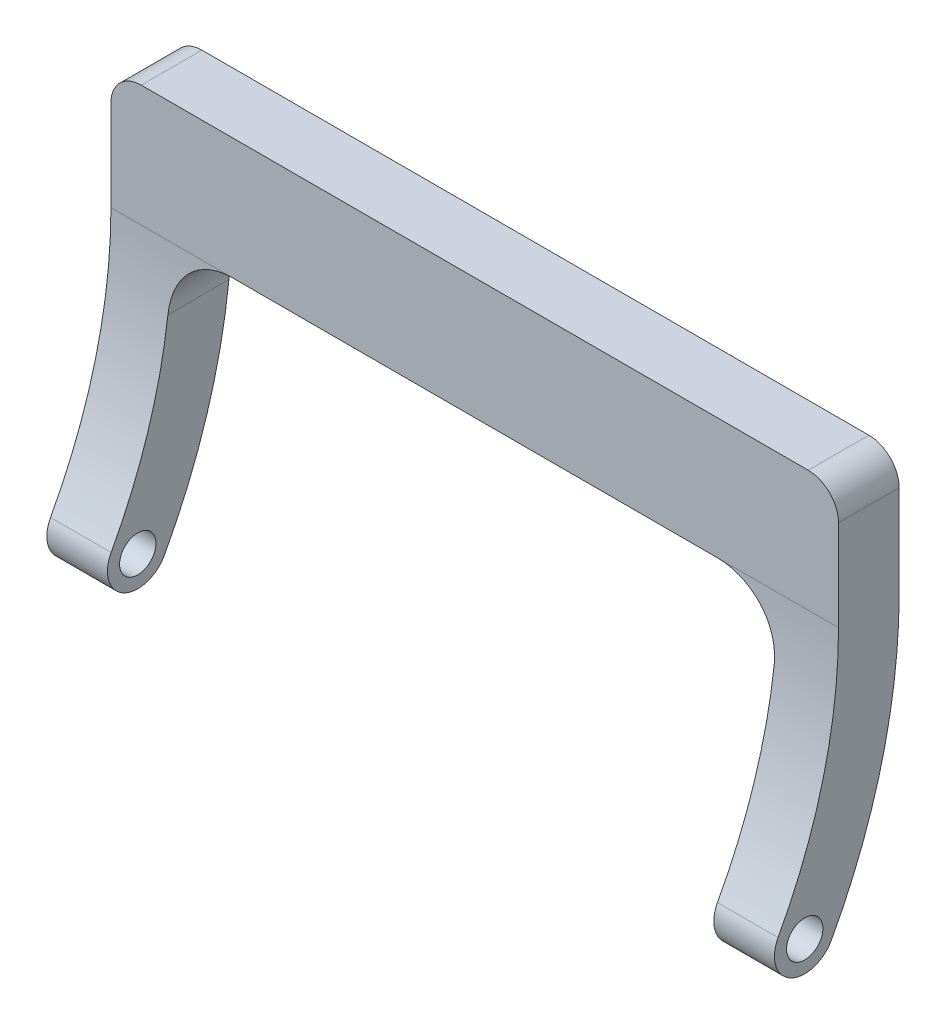
from build123d import *

# Parameters (mm, degrees)
BOSS_EXTRU_1_DEPTH      = 5
ESQUISSE3_R             = 1.5
BOSS_EXTRU_2_DEPTH      = 5
CONG_1_R                = 5
ENL_V_START             = -1.5
ESQUISSE4_R             = 2
ENL_V_MAT_EXTRU_1_DEPTH = 2


with BuildPart() as part:
    # Esquisse2 → Boss.-Extru.1 (new body)
    with BuildSketch(Plane.XY):
        with BuildLine():
            Line((-27.5, 5), (27.5, 5))
            ThreePointArc((27.5, 5), (29.267766953, 4.267766953), (30, 2.5))
            Line((30, 2.5), (30, -5))
            Line((30, -5), (-30, -5))
            Line((-30, -5), (-30, 2.5))
            ThreePointArc((-30, 2.5), (-29.267766953, 4.267766953), (-27.5, 5))
        make_face()
    extrude(amount=BOSS_EXTRU_1_DEPTH)

    # Esquisse3 → Boss.-Extru.2 (add)
    with BuildSketch(Plane.ZY.offset(30)):
        with BuildLine():
            ThreePointArc((0, -5), (1.419495531, -16.359810014), (5.590686777, -27.021020765))
            ThreePointArc((5.590686777, -27.021020765), (8.980460201, -28.025727757), (9.985167192, -24.635954333))
            ThreePointArc((9.985167192, -24.635954333), (6.265751924, -15.129444636), (5, -5))
            Line((5, -5), (0, -5))
        make_face()
        with Locations((7.787926985, -25.828487549)):
            Circle(ESQUISSE3_R, mode=Mode.SUBTRACT)
    boss_extru_2 = extrude(amount=-BOSS_EXTRU_2_DEPTH)

    # Symétrie1: Boss.-Extru.2 across plane
    add(boss_extru_2.mirror(Plane(origin=(0, 0, 0), x_dir=(0, 0, 1), z_dir=(1, 0, 0))))

    # Congé1
    # the kernel refuses this fillet: 5 mm, written as the material it adds along each edge
    with BuildSketch(Plane(origin=(-25, -5, 17.5), x_dir=(1, 0, 0), z_dir=(0, 0, -1))) as cong_1_piece_1_section:
        with BuildLine():
            CenterArc((CONG_1_R, CONG_1_R), CONG_1_R, 180, 90)
            Line((0, CONG_1_R), (0, 0))
            Line((0, 0), (CONG_1_R, 0))
        make_face()
    cong_1_piece_1 = extrude(amount=30, mode=Mode.PRIVATE)
    cong_1_piece_1 = cong_1_piece_1 & Plane(origin=(-24.565871858, -5, 46.164376109), x_dir=(0, 0, -1), z_dir=(-1, 0, 0)) * Cylinder(46.164376109, 80, mode=Mode.PRIVATE)
    cong_1_piece_1 = cong_1_piece_1 - Plane(origin=(-24.565871858, -5, 46.164376109), x_dir=(0, -0.4770132864696082, -0.8788960828968709), z_dir=(-1, 0, 0)) * Cylinder(41.164376109, 80, mode=Mode.PRIVATE)
    add(cong_1_piece_1)
    with BuildSketch(Plane(origin=(25, -5, 17.5), x_dir=(-1, 0, 0), z_dir=(0, 0, -1))) as cong_1_piece_2_section:
        with BuildLine():
            CenterArc((CONG_1_R, -CONG_1_R), CONG_1_R, 90, 90)
            Line((0, -CONG_1_R), (0, 0))
            Line((0, 0), (CONG_1_R, 0))
        make_face()
    cong_1_piece_2 = extrude(amount=30, mode=Mode.PRIVATE)
    cong_1_piece_2 = cong_1_piece_2 & Plane(origin=(24.565871858, -5, 46.164376109), x_dir=(0, 0, -1), z_dir=(1, 0, 0)) * Cylinder(46.164376109, 80, mode=Mode.PRIVATE)
    cong_1_piece_2 = cong_1_piece_2 - Plane(origin=(24.565871858, -5, 46.164376109), x_dir=(0, -0.4770132864696082, -0.8788960828968709), z_dir=(1, 0, 0)) * Cylinder(41.164376109, 80, mode=Mode.PRIVATE)
    add(cong_1_piece_2)

    # Esquisse4 → Enlèv. mat.-Extru.1 (cut)
    with BuildSketch(Plane(origin=(0, 0, 0), x_dir=(-1, 0, 0), z_dir=(0, 0, -1)).offset(ENL_V_START)):
        with Locations((-20, 0)):
            Circle(ESQUISSE4_R)
        with Locations((20, 0)):
            Circle(ESQUISSE4_R)
    extrude(amount=-ENL_V_MAT_EXTRU_1_DEPTH, mode=Mode.SUBTRACT)


solid = part.part
